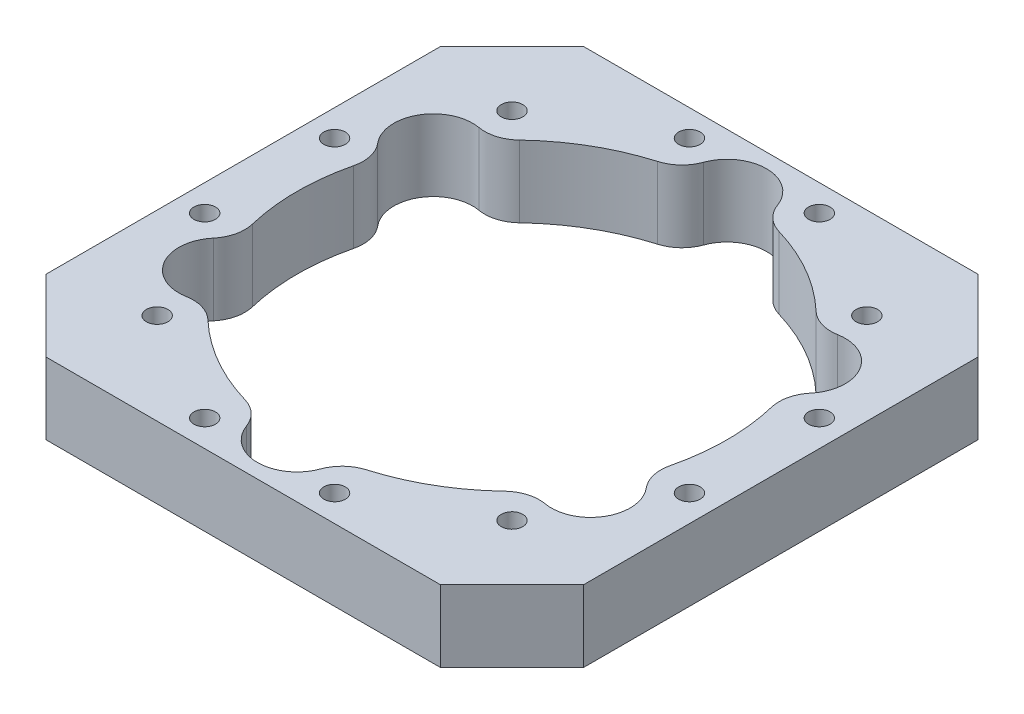
from build123d import *

# Parameters (mm, degrees)
SKETCH1_W           = 75
SKETCH1_H           = 75
SKETCH1_R           = 1.5
BOSS_EXTRUDE1_DEPTH = 10
FILLET1_R           = 5
CHAMFER1_SIZE       = 10


with BuildPart() as part:
    # Sketch1 → Boss-Extrude1 (new body)
    with BuildSketch(Plane(origin=(0, 0, 0), x_dir=(1, 0, 0), z_dir=(0, 1, 0))):
        Rectangle(SKETCH1_W, SKETCH1_H)
        with Locations((-24.748737342, -24.748737342)):
            Circle(SKETCH1_R, mode=Mode.SUBTRACT)
        with Locations((-9.058666579, -33.80740392)):
            Circle(SKETCH1_R, mode=Mode.SUBTRACT)
        with Locations((-33.80740392, -9.058666579)):
            Circle(SKETCH1_R, mode=Mode.SUBTRACT)
        with Locations((9.058666579, -33.80740392)):
            Circle(SKETCH1_R, mode=Mode.SUBTRACT)
        with Locations((24.748737342, -24.748737342)):
            Circle(SKETCH1_R, mode=Mode.SUBTRACT)
        with Locations((33.80740392, -9.058666579)):
            Circle(SKETCH1_R, mode=Mode.SUBTRACT)
        with Locations((-33.80740392, 9.058666579)):
            Circle(SKETCH1_R, mode=Mode.SUBTRACT)
        with Locations((-24.748737342, 24.748737342)):
            Circle(SKETCH1_R, mode=Mode.SUBTRACT)
        with Locations((-9.058666579, 33.80740392)):
            Circle(SKETCH1_R, mode=Mode.SUBTRACT)
        with BuildLine():
            ThreePointArc((28.282562779, 10.004830964), (29.567523428, 5.075584529), (30, 0))
            ThreePointArc((30, 0), (29.567523428, -5.075584529), (28.282562779, -10.004830964))
            ThreePointArc((28.282562779, -10.004830964), (30.612711145, -12.034355354), (31.480762114, -15))
            ThreePointArc((31.480762114, -15), (28.509325321, -19.884298118), (22.805719165, -19.491002369))
            ThreePointArc((22.805719165, -19.491002369), (15, -25.980762114), (5.476843614, -29.495833333))
            ThreePointArc((5.476843614, -29.495833333), (5.494207854, -29.747650913), (5.5, -30))
            ThreePointArc((5.5, -30), (-0.252349087, -35.494207854), (-5.476843614, -29.495833333))
            ThreePointArc((-5.476843614, -29.495833333), (-15, -25.980762114), (-22.805719165, -19.491002369))
            ThreePointArc((-22.805719165, -19.491002369), (-30.743901834, -17.75), (-28.282562779, -10.004830964))
            ThreePointArc((-28.282562779, -10.004830964), (-30, 0), (-28.282562779, 10.004830964))
            ThreePointArc((-28.282562779, 10.004830964), (-30.743901834, 17.75), (-22.805719165, 19.491002369))
            ThreePointArc((-22.805719165, 19.491002369), (-15, 25.980762114), (-5.476843614, 29.495833333))
            ThreePointArc((-5.476843614, 29.495833333), (-0.252349087, 35.494207854), (5.5, 30))
            ThreePointArc((5.5, 30), (5.494207854, 29.747650913), (5.476843614, 29.495833333))
            ThreePointArc((5.476843614, 29.495833333), (15, 25.980762114), (22.805719165, 19.491002369))
            ThreePointArc((22.805719165, 19.491002369), (28.509325321, 19.884298118), (31.480762114, 15))
            ThreePointArc((31.480762114, 15), (30.612711145, 12.034355354), (28.282562779, 10.004830964))
        make_face(mode=Mode.SUBTRACT)
        with Locations((33.80740392, 9.058666579)):
            Circle(SKETCH1_R, mode=Mode.SUBTRACT)
        with Locations((9.058666579, 33.80740392)):
            Circle(SKETCH1_R, mode=Mode.SUBTRACT)
        with Locations((24.748737342, 24.748737342)):
            Circle(SKETCH1_R, mode=Mode.SUBTRACT)
    extrude(amount=BOSS_EXTRUDE1_DEPTH)

    # Fillet1
    fillet1_edges = [part.edges().sort_by_distance(p)[0] for p in [
        (5.476843614, 5, -29.495833333),
        (22.805719165, 5, -19.491002369),
        (28.282562779, 5, 10.004830964),
        (28.282562779, 5, -10.004830964),
        (22.805719165, 5, 19.491002369),
        (5.476843614, 5, 29.495833333),
        (-5.476843614, 5, 29.495833333),
        (-22.805719165, 5, 19.491002369),
        (-28.282562779, 5, 10.004830964),
        (-28.282562779, 5, -10.004830964),
        (-22.805719165, 5, -19.491002369),
        (-5.476843614, 5, -29.495833333),
    ]]
    fillet(fillet1_edges, radius=FILLET1_R)

    # Chamfer1
    chamfer1_edges = [part.edges().sort_by_distance(p)[0] for p in [
        (-37.5, 5, 37.5),
        (37.5, 5, 37.5),
        (37.5, 5, -37.5),
        (-37.5, 5, -37.5),
    ]]
    chamfer(chamfer1_edges, length=CHAMFER1_SIZE)


solid = part.part
